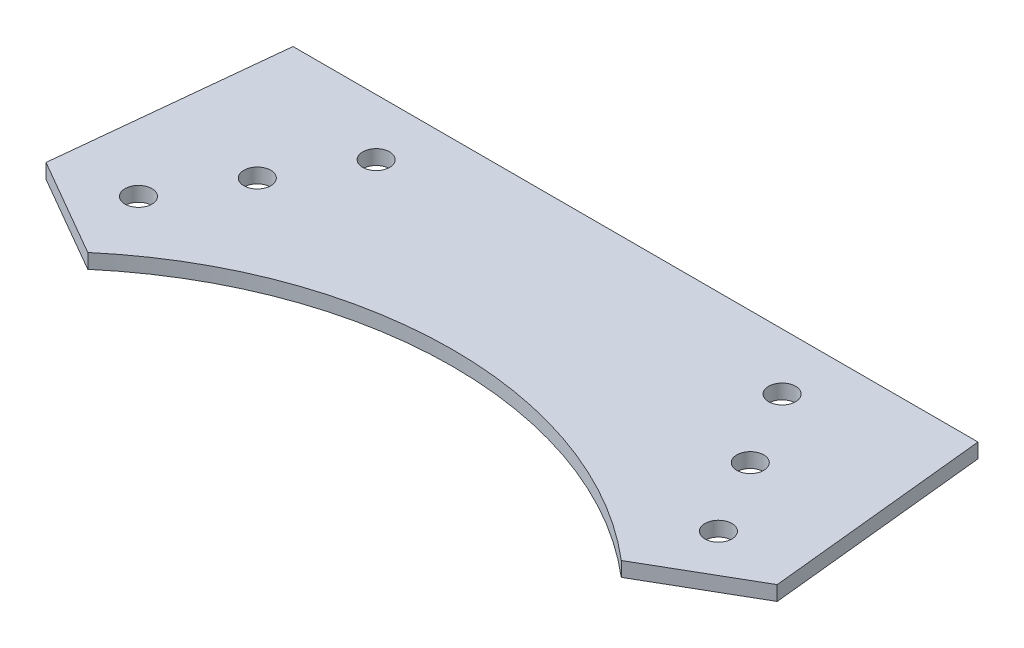
from build123d import *

# Parameters (mm, degrees)
BOSS_EXTRUDE1_DEPTH   = 1.6
F_4_CLEARANCE_HOLE1_D = 2.9464


with BuildPart() as part:
    # Sketch1 → Boss-Extrude1 (new body)
    with BuildSketch(Plane(origin=(0, 0, 0), x_dir=(1, 0, 0), z_dir=(0, 1, 0))):
        with BuildLine():
            Line((-37.5, -32.3215), (37.5, -32.3215))
            Line((37.5, -32.3215), (40.031998944, -56.837456099))
            Line((40.031998944, -56.837456099), (29.206681396, -63.087456099))
            ThreePointArc((29.206681396, -63.087456099), (0, -52.3215), (-29.206681396, -63.087456099))
            Line((-29.206681396, -63.087456099), (-40.031998944, -56.837456099))
            Line((-40.031998944, -56.837456099), (-37.5, -32.3215))
        make_face()
    extrude(amount=BOSS_EXTRUDE1_DEPTH)

    # #4 Clearance Hole1 (through all)
    with Locations(Plane(origin=(0, 1.6, 0), x_dir=(1, 0, 0), z_dir=(0, 1, 0))):
        with Locations((22.225, -38.494829198), (26.9875, -46.743721169), (31.75, -54.99261314)):
            f_4_clearance_hole1 = Hole(F_4_CLEARANCE_HOLE1_D / 2)

    # Mirror1: #4 Clearance Hole1 across plane
    add(f_4_clearance_hole1.mirror(Plane(origin=(0, 0, 0), x_dir=(0, 0, 1), z_dir=(1, 0, 0))), mode=Mode.SUBTRACT)


solid = part.part
